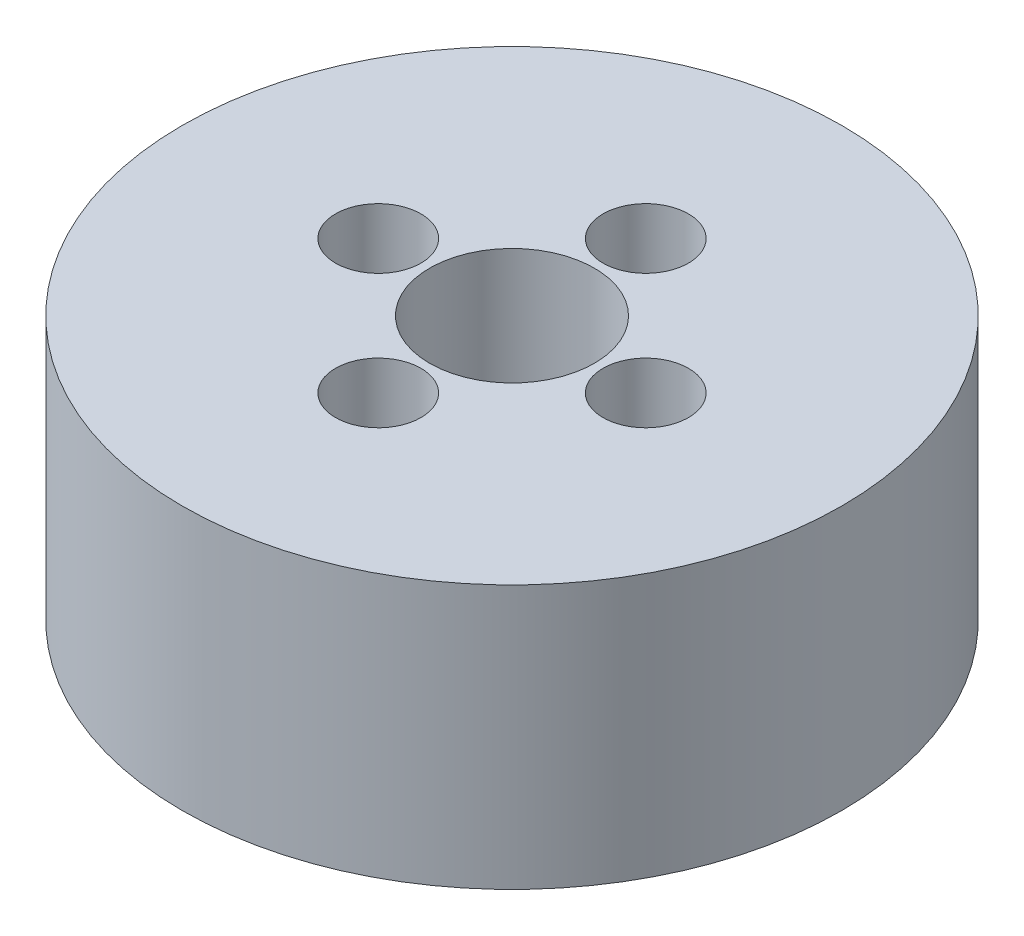
from build123d import *

# Parameters (mm, degrees)
SKETCH1_R           = 30
BOSS_EXTRUDE1_DEPTH = 24
SKETCH2_R           = 7.5
CUT_EXTRUDE1_DEPTH  = 49.744230428
SKETCH3_R           = 3.887332956
CUT_EXTRUDE2_DEPTH  = 22.015476488
CIRPATTERN1_COUNT   = 4


with BuildPart() as part:
    # Sketch1 → Boss-Extrude1 (new body)
    with BuildSketch(Plane(origin=(0, 0, 0), x_dir=(1, 0, 0), z_dir=(0, 1, 0))):
        Circle(SKETCH1_R)
    extrude(amount=BOSS_EXTRUDE1_DEPTH)

    # Sketch2 → Cut-Extrude1 (cut, through all)
    with BuildSketch(Plane(origin=(0, 0, 0), x_dir=(1, 0, 0), z_dir=(0, 1, 0))):
        Circle(SKETCH2_R)
    extrude(amount=CUT_EXTRUDE1_DEPTH, mode=Mode.SUBTRACT)

    # Sketch3 → Cut-Extrude2 (cut)
    with BuildSketch(Plane(origin=(0, 24, 0), x_dir=(1, 0, 0), z_dir=(0, 1, 0))):
        with Locations((-12.170491049, 0)):
            Circle(SKETCH3_R)
    cut_extrude2 = extrude(amount=-CUT_EXTRUDE2_DEPTH, mode=Mode.SUBTRACT)

    # CirPattern1: Cut-Extrude2 ×4 about axis
    cirpattern1_axis = Axis((0, 0, 0), (0, 1, 0))
    for i in range(1, CIRPATTERN1_COUNT):
        add(cut_extrude2.rotate(cirpattern1_axis, i * 360 / CIRPATTERN1_COUNT), mode=Mode.SUBTRACT)


solid = part.part
